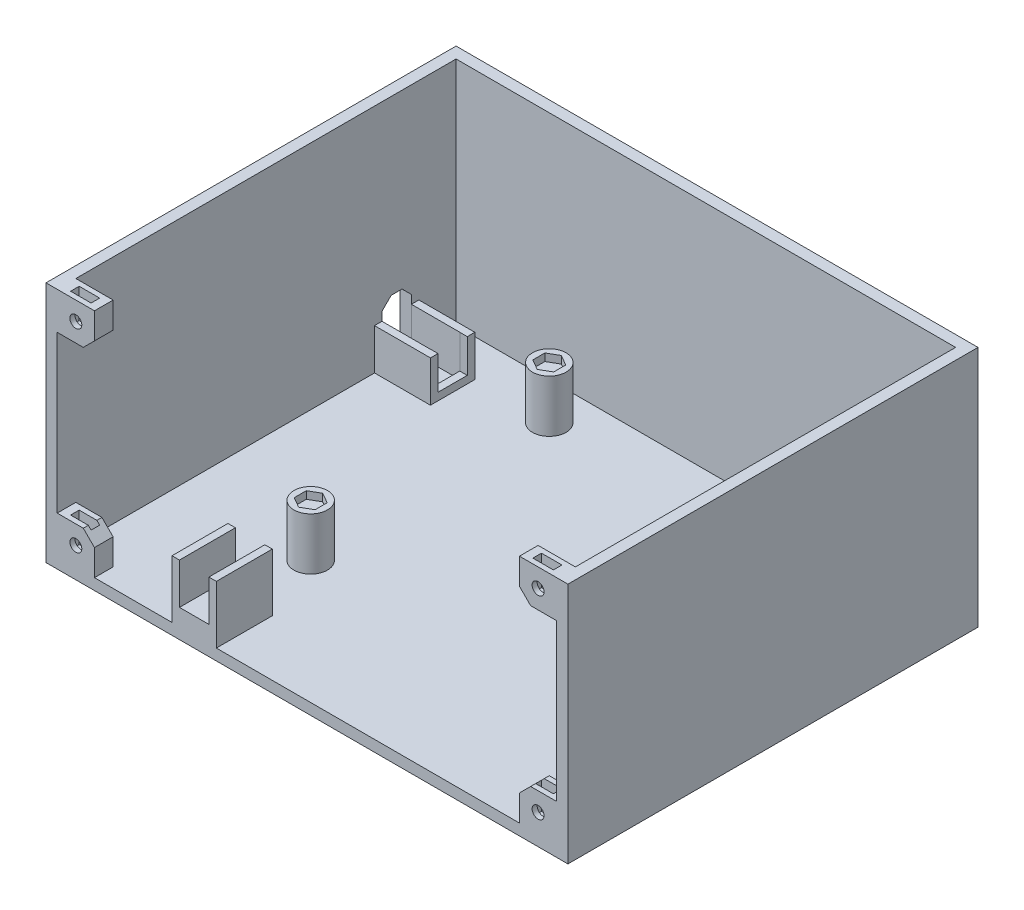
from build123d import *

# Parameters (mm, degrees)
SKETCH_2_W          = 140
SKETCH_2_H          = 65
EXTRUDE_1_DEPTH     = 110
SKETCH_3_W          = 134
SKETCH_3_H          = 107
CUT_EXTRUDE_1_DEPTH = 62
SKETCH_4_W          = 10
SKETCH_4_H          = 10
SKETCH_4_R          = 1.6
EXTRUDE_2_DEPTH     = 5
SKETCH_5_W          = 10
SKETCH_5_H          = 10
SKETCH_5_R          = 1.6
EXTRUDE_3_DEPTH     = 5
SKETCH_6_W          = 5.5
SKETCH_6_H          = 2.3
CUT_EXTRUDE_2_DEPTH = 8
SKETCH_8_W          = 5.5
SKETCH_8_H          = 2.3
CUT_EXTRUDE_3_DEPTH = 8
CHAMFER_1_SIZE      = 3
SKETCH_9_R          = 4.5
EXTRUDE_4_DEPTH     = 14
CUT_EXTRUDE_4_DEPTH = 2
CUT_EXTRUDE_5_REACH = 182.987
EXTRUDE_5_DEPTH     = 11
SKETCH_16_W         = 5.817441426
SKETCH_16_H         = 7.857396667
CUT_EXTRUDE_6_DEPTH = 9
EXTRUDE_6_DEPTH     = 15.5
SKETCH_18_W         = 7.9
SKETCH_18_H         = 11.370001712
CUT_EXTRUDE_7_DEPTH = 9.5
SKETCH_19_W         = 7.9
SKETCH_19_H         = 13
EXTRUDE_7_DEPTH     = 4.5


with BuildPart() as part:
    # Эскиз2 → Бобышка-Вытянуть1 (new body)
    with BuildSketch(Plane.XY):
        Rectangle(SKETCH_2_W, SKETCH_2_H)
    extrude(amount=EXTRUDE_1_DEPTH)

    # Эскиз3 → Вырез-Вытянуть1 (cut)
    with BuildSketch(Plane(origin=(0, 32.5, 0), x_dir=(1, 0, 0), z_dir=(0, 1, 0))):
        with Locations((0, -56.5)):
            Rectangle(SKETCH_3_W, SKETCH_3_H)
    extrude(amount=-CUT_EXTRUDE_1_DEPTH, mode=Mode.SUBTRACT)

    # Эскиз4 → Бобышка-Вытянуть2 (add)
    # profile 1 of 2: a face of its own
    with BuildSketch(Plane.XY.offset(110)):
        with Locations((62, -24.5)):
            Rectangle(SKETCH_4_W, SKETCH_4_H)
        with Locations((62, -24.5)):
            Circle(SKETCH_4_R, mode=Mode.SUBTRACT)
    # profile 2 of 2: a face of its own
    with BuildSketch(Plane.XY.offset(110)):
        with Locations((-62, -24.5)):
            Rectangle(SKETCH_4_W, SKETCH_4_H)
        with Locations((-62, -24.5)):
            Circle(SKETCH_4_R, mode=Mode.SUBTRACT)
    extrude(amount=-EXTRUDE_2_DEPTH)

    # Эскиз5 → Бобышка-Вытянуть3 (add)
    # profile 1 of 2: a face of its own
    with BuildSketch(Plane.XY.offset(110)):
        with Locations((62, 27.5)):
            Rectangle(SKETCH_5_W, SKETCH_5_H)
        with Locations((62, 27.5)):
            Circle(SKETCH_5_R, mode=Mode.SUBTRACT)
    # profile 2 of 2: a face of its own
    with BuildSketch(Plane.XY.offset(110)):
        with Locations((-62, 27.5)):
            Rectangle(SKETCH_5_W, SKETCH_5_H)
        with Locations((-62, 27.5)):
            Circle(SKETCH_5_R, mode=Mode.SUBTRACT)
    extrude(amount=-EXTRUDE_3_DEPTH)

    # Эскиз6 → Вырез-Вытянуть2 (cut)
    with BuildSketch(Plane(origin=(0, 32.5, 0), x_dir=(1, 0, 0), z_dir=(0, 1, 0))):
        with Locations((-62, -107.5)):
            Rectangle(SKETCH_6_W, SKETCH_6_H)
        with Locations((62, -107.5)):
            Rectangle(SKETCH_6_W, SKETCH_6_H)
    extrude(amount=-CUT_EXTRUDE_2_DEPTH, mode=Mode.SUBTRACT)

    # Эскиз8 → Вырез-Вытянуть3 (cut)
    with BuildSketch(Plane(origin=(0, -19.5, 0), x_dir=(1, 0, 0), z_dir=(0, 1, 0))):
        with Locations((62, -107.5)):
            Rectangle(SKETCH_8_W, SKETCH_8_H)
        with Locations((-62, -107.5)):
            Rectangle(SKETCH_8_W, SKETCH_8_H)
    extrude(amount=-CUT_EXTRUDE_3_DEPTH, mode=Mode.SUBTRACT)

    # Фаска1
    # the kernel refuses this chamfer: 3 mm, written as the material it takes off along each edge
    with BuildSketch(Plane(origin=(57, 22.5, 117.715048964), x_dir=(-0.027495876610586768, 0.9996219169112968, 0), z_dir=(0, 0, -1))) as chamfer_1_piece_1:
        Polygon((CHAMFER_1_SIZE * 0.999621916911, CHAMFER_1_SIZE * 0.0274958766106), (-CHAMFER_1_SIZE * 0.0274958766106, CHAMFER_1_SIZE * 0.999621916911), (0, 0), align=None)
    extrude(amount=20.430097928, mode=Mode.SUBTRACT)
    with BuildSketch(Plane(origin=(57, -19.5, 117.715048964), x_dir=(-0.027495876610586768, -0.9996219169112968, 0), z_dir=(0, 0, -1)), Plane(origin=(-57, 22.5, 117.715048964), x_dir=(0.027495876610586733, 0.9996219169112968, 0), z_dir=(0, 0, -1)), Plane(origin=(-57, -19.5, 117.715048964), x_dir=(-0.9996219169112965, 0.02749587661058676, 0), z_dir=(0, 0, -1))) as chamfer_1_piece_2:
        Polygon((CHAMFER_1_SIZE * 0.999621916911, -CHAMFER_1_SIZE * 0.0274958766106), (-CHAMFER_1_SIZE * 0.0274958766106, -CHAMFER_1_SIZE * 0.999621916911), (0, 0), align=None)
    extrude(amount=20.430097928, mode=Mode.SUBTRACT)

    # Эскиз9 → Бобышка-Вытянуть4 (add)
    with BuildSketch(Plane(origin=(0, -29.5, 0), x_dir=(1, 0, 0), z_dir=(0, 1, 0))):
        with Locations(Location((54, -13, 0), (0, 0, 270))):
            Circle(SKETCH_9_R)
        with Locations(Location((-32, -13, 0), (0, 0, 270))):
            Circle(SKETCH_9_R)
        with Locations(Location((-32, -77, 0), (0, 0, 270))):
            Circle(SKETCH_9_R)
        with Locations(Location((54, -77, 0), (0, 0, 270))):
            Circle(SKETCH_9_R)
    extrude(amount=EXTRUDE_4_DEPTH)

    # Эскиз12 → Вырез-Вытянуть4 (cut)
    with BuildSketch(Plane(origin=(0, -15.5, 0), x_dir=(1, 0, 0), z_dir=(0, 1, 0))):
        Polygon((54, -9.766838493), (51.2, -11.383419246), (51.2, -14.616580754), (54, -16.233161507), (56.8, -14.616580754), (56.8, -11.383419246), align=None)
        Polygon((-32, -9.766838493), (-34.8, -11.383419246), (-34.8, -14.616580754), (-32, -16.233161507), (-29.2, -14.616580754), (-29.2, -11.383419246), align=None)
        Polygon((54, -73.766838493), (51.2, -75.383419246), (51.2, -78.616580754), (54, -80.233161507), (56.8, -78.616580754), (56.8, -75.383419246), align=None)
        Polygon((-32, -73.766838493), (-34.8, -75.383419246), (-34.8, -78.616580754), (-32, -80.233161507), (-29.2, -78.616580754), (-29.2, -75.383419246), align=None)
    extrude(amount=-CUT_EXTRUDE_4_DEPTH, mode=Mode.SUBTRACT)

    # Эскиз13 → Вырез-Вытянуть5 (cut, up to next)
    with BuildSketch(Plane.ZY.offset(70), mode=Mode.PRIVATE) as cut_extrude_5_sk1:
        Polygon((15, -29.3), (22.9, -29.3), (22.9, -16.2), (20.405788704, -13.7), (17.494211296, -13.7), (15, -16.2), align=None)
    cut_extrude_5_tool1 = extrude(cut_extrude_5_sk1.sketch, amount=-CUT_EXTRUDE_5_REACH, mode=Mode.PRIVATE) & part.part
    add(cut_extrude_5_tool1.solids().sort_by_distance((-70, -21.871275, 18.95))[0], mode=Mode.SUBTRACT)

    # Эскиз15 → Бобышка-Вытянуть5 (add)
    with BuildSketch(Plane(origin=(0, -29.5, 0), x_dir=(1, 0, 0), z_dir=(0, 1, 0))):
        Polygon((-67, -24.878202282), (-52, -24.878202282), (-52, -12.978202282), (-67, -12.978202282), (-67, -14.978202282), (-54, -14.978202282), (-54, -22.878202282), (-67, -22.878202282), align=None)
    extrude(amount=EXTRUDE_5_DEPTH)

    # Эскиз16 → Вырез-Вытянуть6 (cut)
    with BuildSketch(Plane(origin=(0, -18.5, 0), x_dir=(1, 0, 0), z_dir=(0, 1, 0))):
        with Locations((-52, -18.928202283)):
            Rectangle(SKETCH_16_W, SKETCH_16_H)
    extrude(amount=-CUT_EXTRUDE_6_DEPTH, mode=Mode.SUBTRACT)

    # Эскиз17 → Бобышка-Вытянуть6 (add)
    with BuildSketch(Plane(origin=(0, -29.5, 0), x_dir=(1, 0, 0), z_dir=(0, 1, 0))):
        Polygon((-36.2, -110), (-36.2, -95), (-24.3, -95), (-24.3, -110), (-26.3, -110), (-26.3, -97), (-34.2, -97), (-34.2, -110), align=None)
    extrude(amount=EXTRUDE_6_DEPTH)

    # Эскиз18 → Вырез-Вытянуть7 (cut)
    with BuildSketch(Plane(origin=(0, -14, 0), x_dir=(1, 0, 0), z_dir=(0, 1, 0))):
        with Locations((-30.25, -95)):
            Rectangle(SKETCH_18_W, SKETCH_18_H)
    extrude(amount=-CUT_EXTRUDE_7_DEPTH, mode=Mode.SUBTRACT)

    # Эскиз19 → Бобышка-Вытянуть7 (add)
    with BuildSketch(Plane(origin=(0, -29.5, 0), x_dir=(1, 0, 0), z_dir=(0, 1, 0))):
        with Locations((-30.25, -103.5)):
            Rectangle(SKETCH_19_W, SKETCH_19_H)
    extrude(amount=EXTRUDE_7_DEPTH)


solid = part.part
